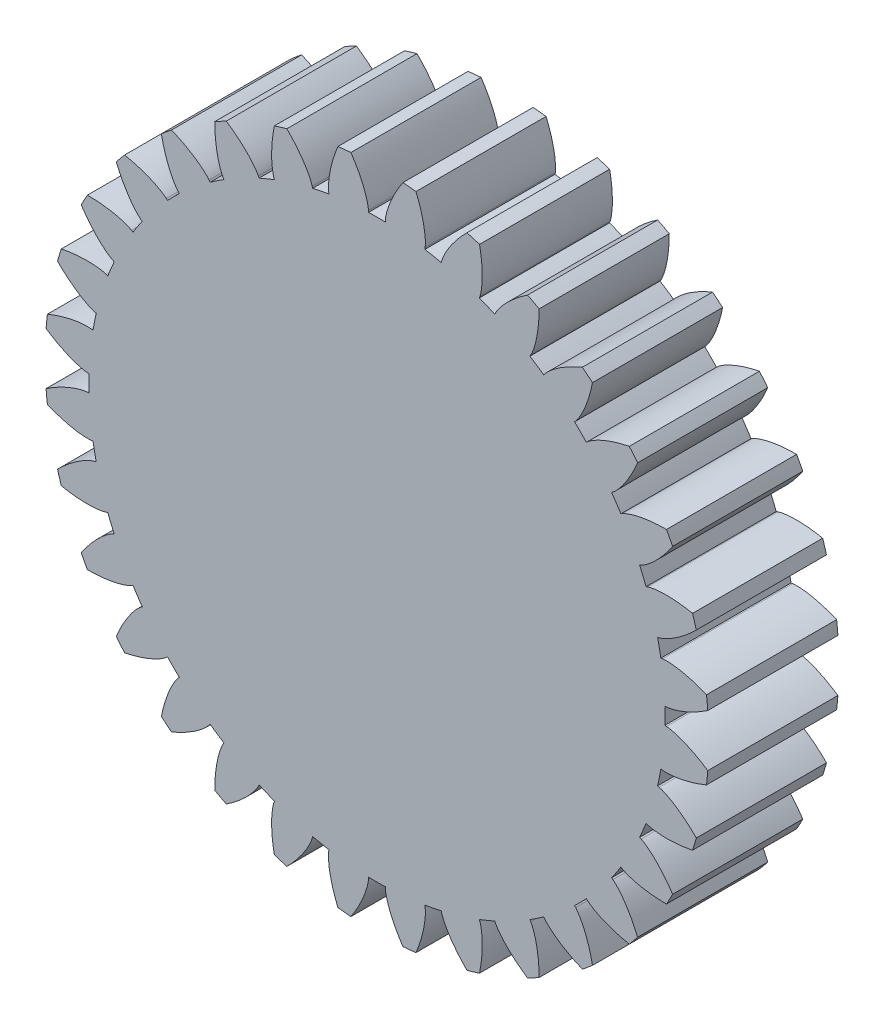
from build123d import *

# Parameters (mm, degrees)
SKETCH1_R           = 51
BOSS_EXTRUDE1_DEPTH = 20
CUT_EXTRUDE3_DEPTH  = 75.846509605
CIRPATTERN1_COUNT   = 32


with BuildPart() as part:
    # Sketch1 → Boss-Extrude1 (new body)
    with BuildSketch(Plane.XY):
        Circle(SKETCH1_R)
    extrude(amount=BOSS_EXTRUDE1_DEPTH)

    # Sketch3 → Cut-Extrude3 (cut, through all)
    with BuildSketch(Plane.XY):
        with BuildLine():
            add(Edge.make_bspline(
                [(1.29203821, 44.486066215), (1.302814451, 44.668832694), (1.366057296, 45.076437929), (1.534105828, 45.789290586), (1.827270897, 46.705234433), (2.128888857, 47.445621669), (2.32719165, 47.88141557), (2.355248368, 47.942181898)],
                knots=[0, 0, 0, 0, 0.040008387, 0.090017613, 0.160030412, 0.250046806, 0.264674884, 0.264674884, 0.264674884, 0.264674884], degree=3))
            add(Edge.make_bspline(
                [(2.355248368, 47.942181898), (2.787245487, 48.877818018), (3.339216628, 49.848020835), (3.952343038, 50.775687882), (3.997367676, 50.843102302)],
                knots=[0.264674884, 0.264674884, 0.264674884, 0.264674884, 0.489907489, 0.507621482, 0.507621482, 0.507621482, 0.507621482], degree=3))
            ThreePointArc((3.997367676, 50.843102302), (0, 51), (-3.997367676, 50.843102302))
            add(Edge.make_bspline(
                [(-2.355248368, 47.942181898), (-2.787245487, 48.877818018), (-3.339216628, 49.848020835), (-3.952343038, 50.775687882), (-3.997367676, 50.843102302)],
                knots=[0.264674884, 0.264674884, 0.264674884, 0.264674884, 0.489907489, 0.507621482, 0.507621482, 0.507621482, 0.507621482], degree=3))
            add(Edge.make_bspline(
                [(-1.29203821, 44.486066215), (-1.302814451, 44.668832694), (-1.366057296, 45.076437929), (-1.534105828, 45.789290586), (-1.827270897, 46.705234433), (-2.128888857, 47.445621669), (-2.32719165, 47.88141557), (-2.355248368, 47.942181898)],
                knots=[0, 0, 0, 0, 0.040008387, 0.090017613, 0.160030412, 0.250046806, 0.264674884, 0.264674884, 0.264674884, 0.264674884], degree=3))
            Line((-1.29203821, 44.486066215), (-1.284640278, 44.231348604))
            ThreePointArc((-1.284640278, 44.231348604), (0, 44.25), (1.284640278, 44.231348604))
            Line((1.284640278, 44.231348604), (1.29203821, 44.486066215))
        make_face()
    cut_extrude3 = extrude(amount=CUT_EXTRUDE3_DEPTH, mode=Mode.SUBTRACT)

    # CirPattern1: Cut-Extrude3 ×32 about axis
    cirpattern1_axis = Axis((0, 0, 71.213492813), (0, 0, -1))
    for i in range(1, CIRPATTERN1_COUNT):
        add(cut_extrude3.rotate(cirpattern1_axis, i * 360 / CIRPATTERN1_COUNT), mode=Mode.SUBTRACT)


solid = part.part
